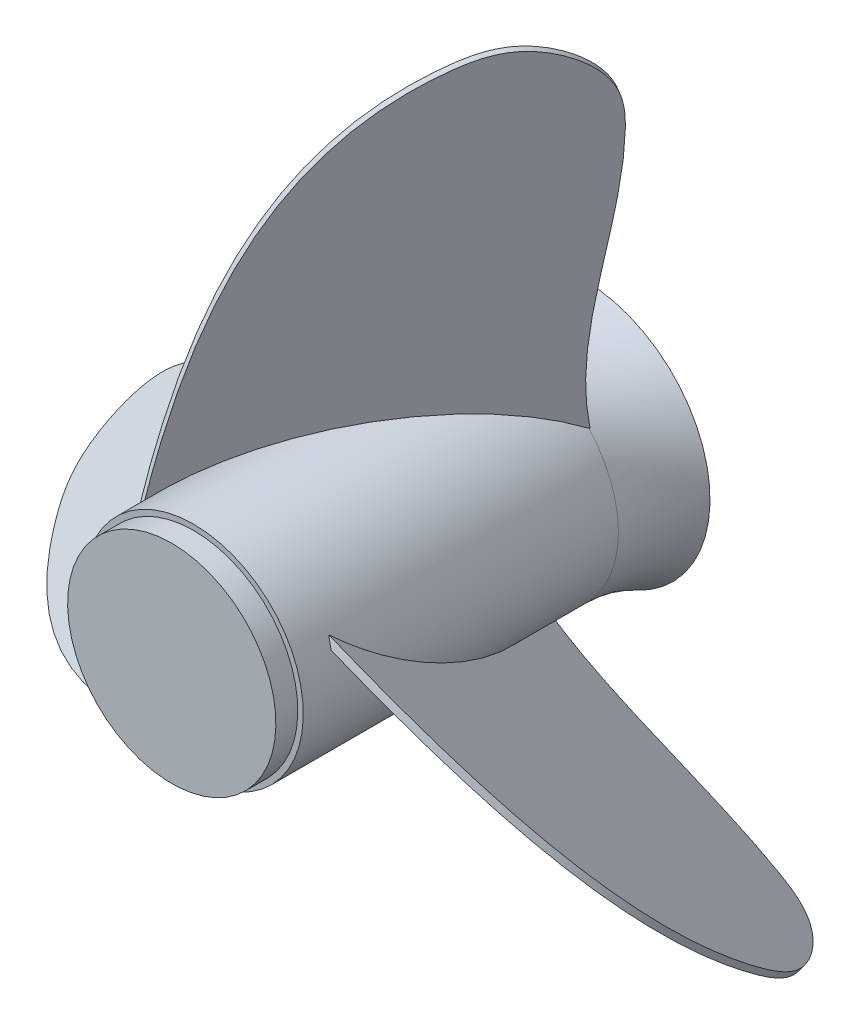
from build123d import *

# Parameters (mm, degrees)
BOSS_EXTRUDE1_DEPTH = 1.25
CIRPATTERN1_COUNT   = 3


with BuildPart() as part:
    # Sketch1 → Revolve1 (revolve)
    with BuildSketch(Plane(origin=(0, 0, 0), x_dir=(0, 0, -1), z_dir=(1, 0, 0))):
        with BuildLine():
            Line((75, 46.418286702), (75, 0))
            Line((75, 0), (-75, 0))
            Line((-75, 0), (-75, 38))
            Line((-75, 38), (-67, 38))
            Line((-67, 38), (-67, 40))
            Line((-67, 40), (48, 40))
            ThreePointArc((48, 40), (61.876188275, 41.626620802), (75, 46.418286702))
        make_face()
    revolve(axis=Axis((0, 0, -75), (0, 0, 1)))

    # Sketch3 → Boss-Extrude1 (add, symmetric)
    with BuildSketch(Plane(origin=(0, 0, 0), x_dir=(0, 1, 0), z_dir=(-0.8660254037844416, 0, -0.49999999999999495))):
        with BuildLine():
            Line((14, 60), (14, -65))
            add(Edge.make_bspline(
                [(14, 60), (49.238473279, 47.174244625), (88.098229626, 67.138265767), (138.880440216, 65.629303793), (153.137608099, 39.563471188), (135.608045166, -24.165020424), (84.677157208, -51.261752333), (14, -65)],
                knots=[0, 0, 0, 0, 0.319630546, 0.366429329, 0.456703552, 0.521189047, 1, 1, 1, 1], degree=3))
        make_face()
    boss_extrude1 = extrude(amount=BOSS_EXTRUDE1_DEPTH, both=True)

    # CirPattern1: Boss-Extrude1 ×3 about axis
    cirpattern1_axis = Axis((0, 0, 75), (0, 0, -1))
    for i in range(1, CIRPATTERN1_COUNT):
        add(boss_extrude1.rotate(cirpattern1_axis, i * 360 / CIRPATTERN1_COUNT))


solid = part.part
